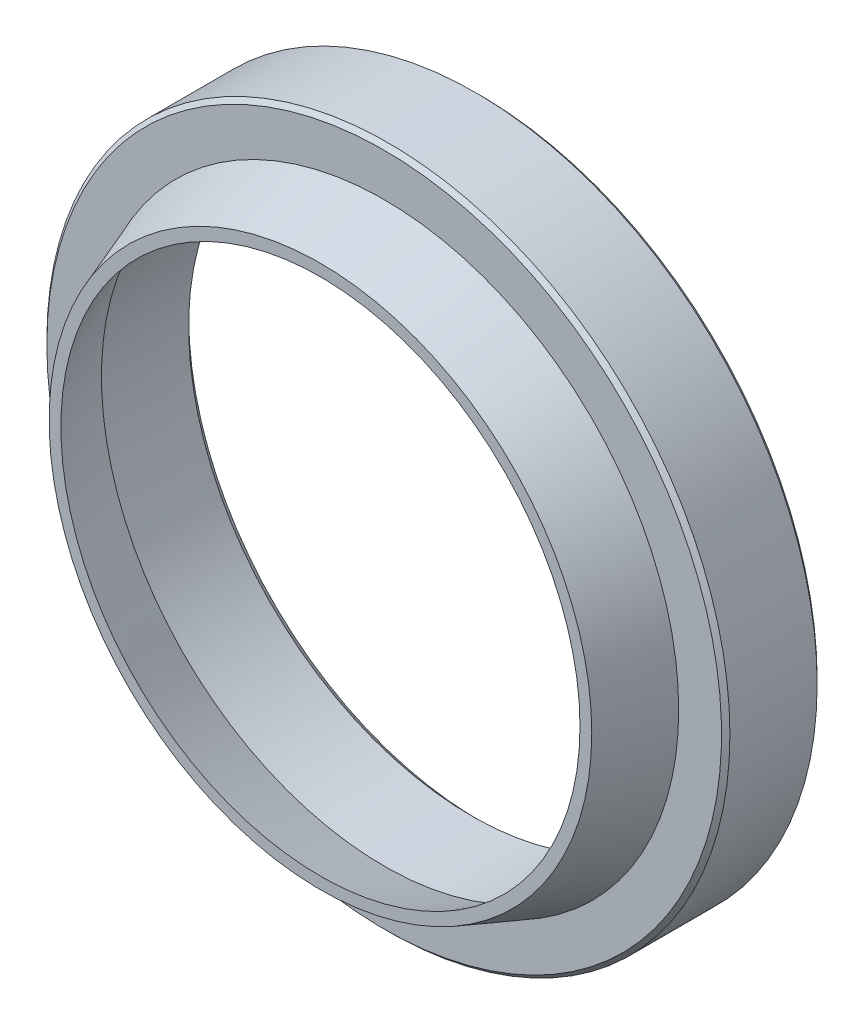
from build123d import *

# Parameters (mm, degrees)
ENDCHAMFER_SIZE  = 0.614285714
BODYCHAMFER_SIZE = 0.307142857


with BuildPart() as part:
    # Sketch1 → Body (revolve)
    with BuildSketch(Plane(origin=(25, 0, -4.51618793), x_dir=(-1, 0, 0), z_dir=(0, 1, 0))):
        Polygon((45.7, -7.150478737), (45.7, -0.154523684), (44, 4.51618793), (44.86147224, 4.51618793), (46.56, -0.150478737), (50, -0.150478737), (50, -7.150478737), align=None)
    revolve(axis=Axis((0, 0, 4.679710754), (0, 0, -1)))

    # EndChamfer
    endchamfer_edges = [part.edges().sort_by_distance(p)[0] for p in [
        (20.7, 0, -11.666666667),
    ]]
    chamfer(endchamfer_edges, length=ENDCHAMFER_SIZE)

    # BodyChamfer
    bodychamfer_edges = [part.edges().sort_by_distance(p)[0] for p in [
        (25, 0, -4.666666667),
        (25, 0, -11.666666667),
    ]]
    chamfer(bodychamfer_edges, length=BODYCHAMFER_SIZE)


solid = part.part
